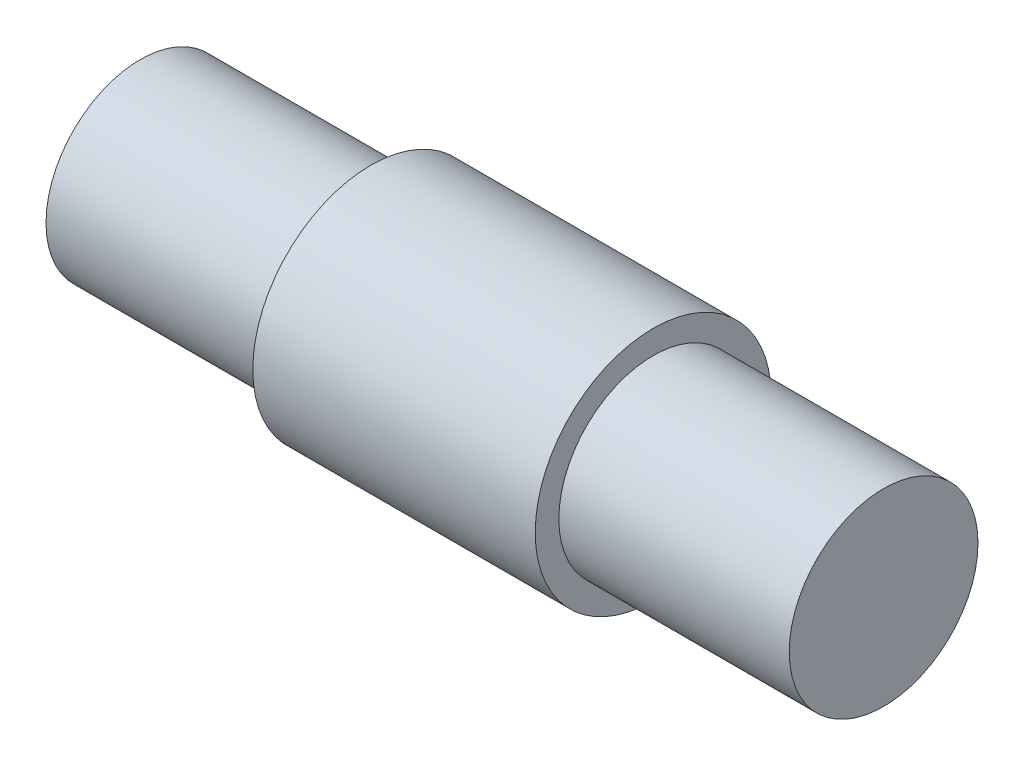
from build123d import *


with BuildPart() as part:
    # Sketch1 → Revolve1 (revolve)
    with BuildSketch(Plane.XY):
        Polygon((-12.5, 0), (-12.5, 3.175), (-4.75, 3.175), (-4.75, 3.96875), (4.75, 3.96875), (4.75, 3.175), (12.5, 3.175), (12.5, 0), align=None)
    revolve(axis=Axis((-76.456488796, 0, 0), (1, 0, 0)))


solid = part.part
